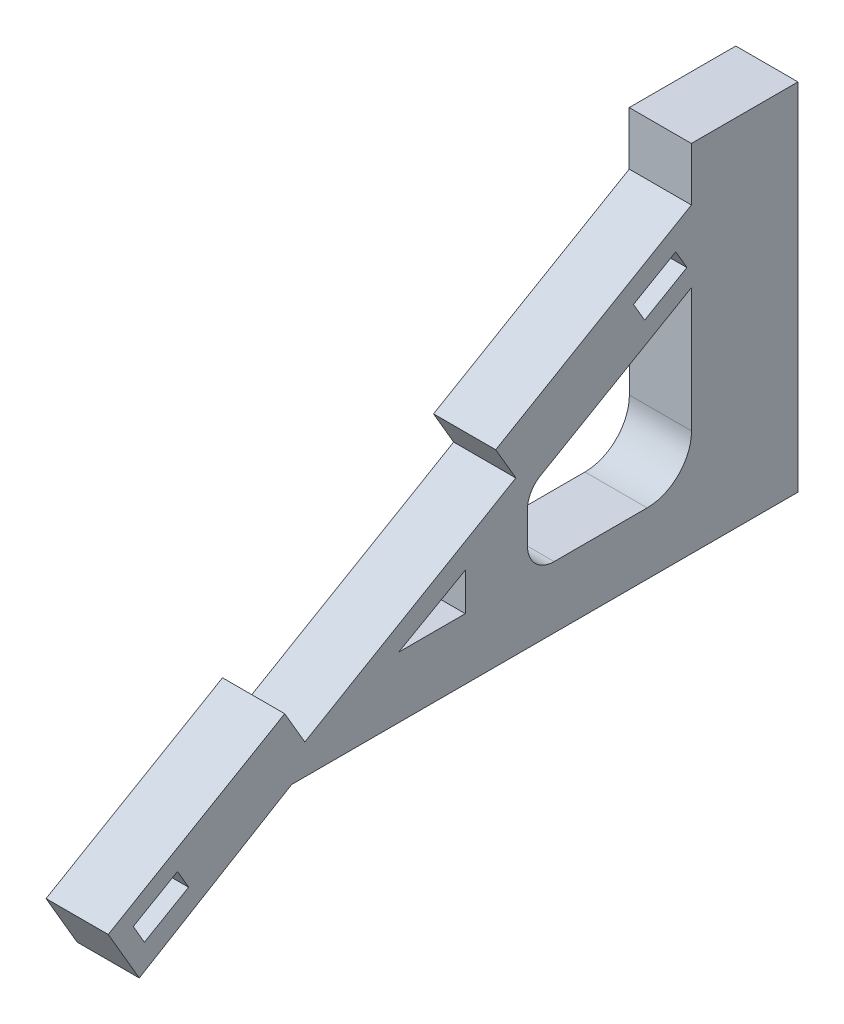
from build123d import *

# Parameters (mm, degrees)
BOSS_EXTRUDE1_DEPTH = 7
FILLET1_R           = 3
FILLET2_R           = 5


with BuildPart() as part:
    # Sketch1 → Boss-Extrude1 (new body)
    with BuildSketch(Plane(origin=(0, 0, 0), x_dir=(0, 0, -1), z_dir=(1, 0, 0))):
        Polygon((-21.785617828, -17.377868865), (35.214382172, -17.377868865), (35.214382172, 22.622131135), (23.214382172, 22.622131135), (23.214382172, 16.622131135), (1.187686697, 3.773991719), (3.455005417, -0.113072189), (-20.299274017, -13.968908814), (-22.566592737, -10.081844907), (-42.433808264, -21.670362811), (-38.937098948, -27.665079148), align=None)
        Polygon((23.234116709, 8.569586546), (23.234116709, -10.417868865), (4.764740561, -10.417868865), (4.764740561, -1.399885987), (6.011600394, -1.399885987), align=None, mode=Mode.SUBTRACT)
        Polygon((-39.613886954, -22.304550046), (-34.634489281, -19.42911985), (-33.384302239, -21.59407536), (-38.363699913, -24.469505556), align=None, mode=Mode.SUBTRACT)
        Polygon((-9.735540794, -10.497868865), (-2.235259439, -10.497868865), (-2.235259439, -6.248372162), align=None, mode=Mode.SUBTRACT)
        Polygon((16.699385829, 10.182861543), (17.951839541, 8.019216032), (22.7118599, 10.774614335), (21.459406188, 12.938259845), align=None, mode=Mode.SUBTRACT)
    extrude(amount=-BOSS_EXTRUDE1_DEPTH)

    # Fillet1
    # the kernel refuses this fillet: 3 mm, written as the material it adds along each edge
    with BuildSketch(Plane(origin=(0, -10.417868865, -4.764740561), x_dir=(0, 0, -1), z_dir=(-1, 0, 0))) as fillet1_piece_1:
        with BuildLine():
            CenterArc((FILLET1_R, -FILLET1_R), FILLET1_R, 90, 90)
            Line((0, -FILLET1_R), (-FILLET1_R * 0.02, -FILLET1_R))
            Line((-FILLET1_R * 0.02, -FILLET1_R), (-FILLET1_R * 0.02, FILLET1_R * 0.02))
            Line((-FILLET1_R * 0.02, FILLET1_R * 0.02), (FILLET1_R, FILLET1_R * 0.02))
            Line((FILLET1_R, FILLET1_R * 0.02), (FILLET1_R, 0))
        make_face()
    extrude(amount=7)
    with BuildSketch(Plane(origin=(0, -1.399885987, -4.764740561), x_dir=(0, -1, 0), z_dir=(-1, 0, 0))) as fillet1_piece_2:
        with BuildLine():
            CenterArc((2.434440295, -3), FILLET1_R, 90, 54.240794128)
            Line((0, -1.246859832), (-0.048688806, -1.211797029))
            ThreePointArc((-0.048688806, -1.211797029), (-0.06, -0.623429916), (-0.06, 0))
            Line((-0.06, 0), (0, 0.06))
            Line((0, 0.06), (2.434440295, 0.06))
            Line((2.434440295, 0.06), (2.434440295, 0))
        make_face()
    extrude(amount=7)

    # Fillet2
    fillet2_edges = [part.edges().sort_by_distance(p)[0] for p in [
        (-3.5, -10.417868865, -23.234116709),
    ]]
    fillet(fillet2_edges, radius=FILLET2_R)


solid = part.part
